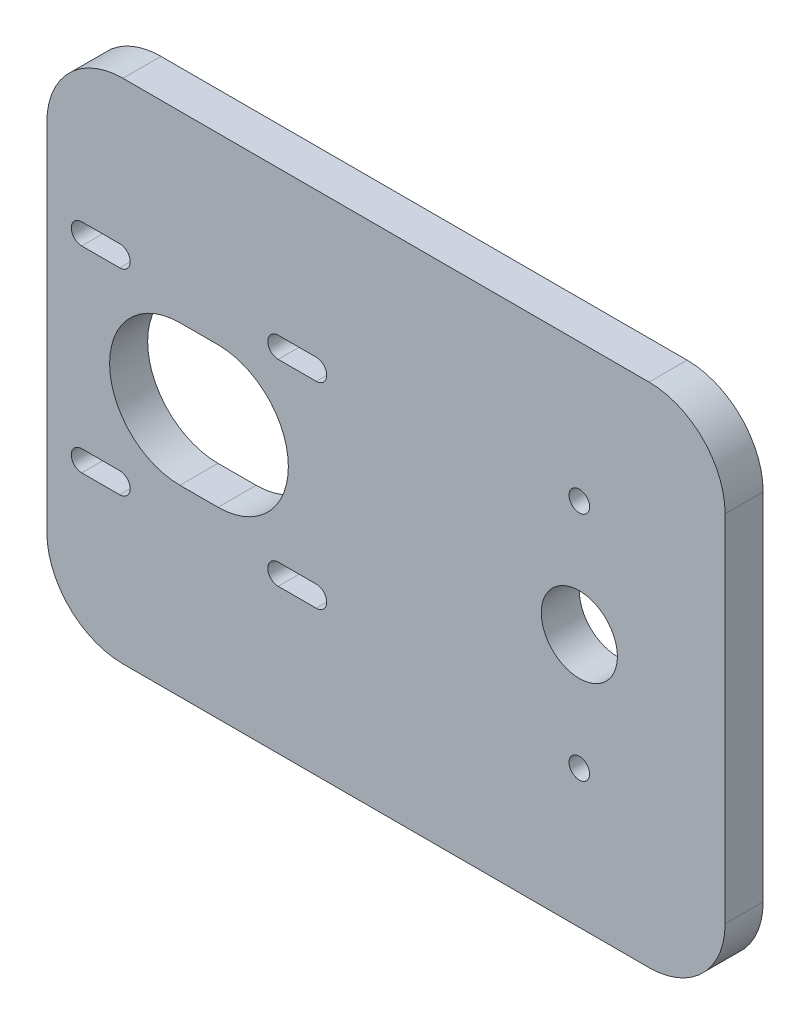
from build123d import *

# Parameters (mm, degrees)
CROQUIS1_W              = 107
CROQUIS1_H              = 80
SALIENTE_EXTRUIR1_DEPTH = 6
CROQUIS2_R              = 6
CROQUIS2_R_2            = 1.625
CORTAR_EXTRUIR1_DEPTH   = 134.734812222
REDONDEO1_R             = 12


with BuildPart() as part:
    # Croquis1 → Saliente-Extruir1 (new body)
    with BuildSketch(Plane.XY):
        with Locations((53.5, 40)):
            Rectangle(CROQUIS1_W, CROQUIS1_H)
    extrude(amount=SALIENTE_EXTRUIR1_DEPTH)

    # Croquis2 → Cortar-Extruir1 (cut, through all)
    with BuildSketch(Plane(origin=(0, 0, 0), x_dir=(-1, 0, 0), z_dir=(0, 0, -1))):
        with Locations((-84, 40)):
            Circle(CROQUIS2_R)
        with Locations((-84, 21.75)):
            Circle(CROQUIS2_R_2)
        with Locations((-84, 58.25)):
            Circle(CROQUIS2_R_2)
        with BuildLine():
            Line((-21, 28.9), (-27, 28.9))
            ThreePointArc((-27, 28.9), (-38.1, 40), (-27, 51.1))
            Line((-27, 51.1), (-21, 51.1))
            ThreePointArc((-21, 51.1), (-9.9, 40), (-21, 28.9))
        make_face()
        with BuildLine():
            Line((-5.5, 22.85), (-11.5, 22.85))
            ThreePointArc((-11.5, 22.85), (-13.15, 24.5), (-11.5, 26.15))
            Line((-11.5, 26.15), (-5.5, 26.15))
            ThreePointArc((-5.5, 26.15), (-3.85, 24.5), (-5.5, 22.85))
        make_face()
        with BuildLine():
            Line((-36.5, 53.85), (-42.5, 53.85))
            ThreePointArc((-42.5, 53.85), (-44.15, 55.5), (-42.5, 57.15))
            Line((-42.5, 57.15), (-36.5, 57.15))
            ThreePointArc((-36.5, 57.15), (-34.85, 55.5), (-36.5, 53.85))
        make_face()
        with BuildLine():
            Line((-36.5, 22.85), (-42.5, 22.85))
            ThreePointArc((-42.5, 22.85), (-44.15, 24.5), (-42.5, 26.15))
            Line((-42.5, 26.15), (-36.5, 26.15))
            ThreePointArc((-36.5, 26.15), (-34.85, 24.5), (-36.5, 22.85))
        make_face()
        with BuildLine():
            Line((-5.5, 53.85), (-11.5, 53.85))
            ThreePointArc((-11.5, 53.85), (-13.15, 55.5), (-11.5, 57.15))
            Line((-11.5, 57.15), (-5.5, 57.15))
            ThreePointArc((-5.5, 57.15), (-3.85, 55.5), (-5.5, 53.85))
        make_face()
    extrude(amount=-CORTAR_EXTRUIR1_DEPTH, mode=Mode.SUBTRACT)

    # Redondeo1
    redondeo1_edges = [part.edges().sort_by_distance(p)[0] for p in [
        (107, 0, 3),
        (107, 80, 3),
        (0, 0, 3),
        (0, 80, 3),
    ]]
    fillet(redondeo1_edges, radius=REDONDEO1_R)


solid = part.part
